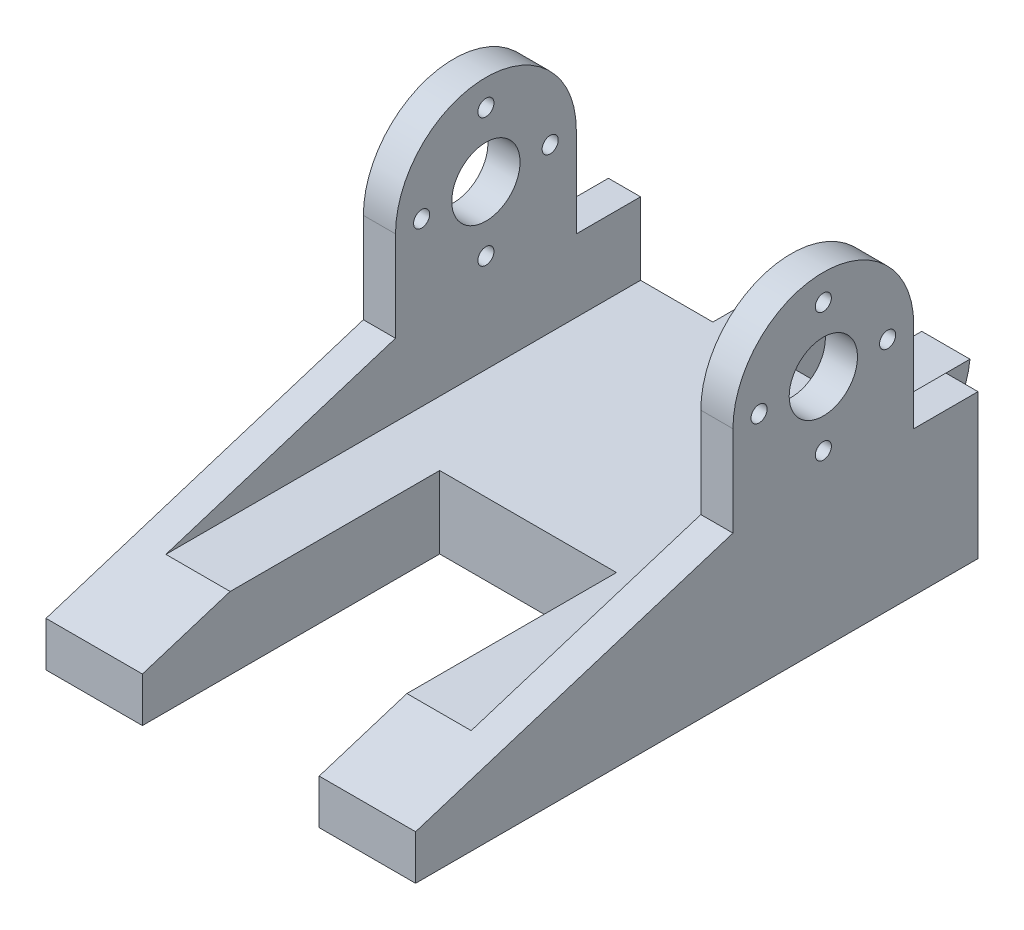
from build123d import *

# Parameters (mm, degrees)
SKETCH1_W                = 50
SKETCH1_H                = 170
BOSS_EXTRUDE1_DEPTH      = 55
SKETCH2_W                = 34
SKETCH2_H                = 27
CUT_EXTRUDE1_DEPTH       = 181.416185527
SKETCH3_W                = 10
SKETCH3_H                = 24
SKETCH3_R                = 4.25
SKETCH3_R_2              = 1
CUT_EXTRUDE2_DEPTH       = 186.539753153
SKETCH4_W                = 2
SKETCH4_H                = 24
CUT_EXTRUDE3_DEPTH       = 178.623196683
SKETCH5_W                = 6.25
SKETCH5_H                = 11.25
CUT_EXTRUDE4_DEPTH       = 186.539753153
SKETCH6_W                = 38
SKETCH6_H                = 10
CUT_EXTRUDE5_DEPTH       = 181.416185527
SKETCH8_W                = 13.25
SKETCH8_H                = 2.25
CUT_EXTRUDE7_DEPTH       = 186.539753153
SKETCH9_W                = 34
SKETCH9_H                = 35.25
CUT_EXTRUDE8_DEPTH       = 179.297679458
SKETCH11_W               = 13.25
SKETCH11_H               = 20.25
CUT_EXTRUDE9_DEPTH       = 184.480414486
SKETCH12_W               = 28.5
SKETCH12_H               = 15
BOSS_EXTRUDE2_DEPTH      = 8
SKETCH14_W               = 34
SKETCH14_H               = 15
SKETCH14_H_2             = 10.25
BOSS_EXTRUDE3_DEPTH      = 13.25
SKETCH16_R               = 4.5
SKETCH16_R_2             = 2.5
CUT_EXTRUDE13_DEPTH      = 8
SKETCH17_R               = 4.5
SKETCH17_W               = 55
SKETCH17_H               = 10.25
CUT_EXTRUDE15_DEPTH      = 175.384811552
SKETCH18_W               = 71.25
SKETCH18_H               = 27.5
SKETCH18_W_2             = 13.75
SKETCH18_W_3             = 16.25
BOSS_EXTRUDE4_DEPTH      = 50
SKETCH19_W               = 38
SKETCH19_H               = 7
CUT_EXTRUDE16_DEPTH      = 152.25227271
SKETCH20_W               = 57.5
SKETCH20_H               = 27.5
CUT_EXTRUDE17_DEPTH      = 102.137591923
CUT_EXTRUDE18_DEPTH      = 100.39221549
SKETCH22_W               = 82.5
SKETCH22_H               = 2.5
BOSS_EXTRUDE5_DEPTH      = 50
SKETCH24_W               = 22
SKETCH24_H               = 17
CUT_EXTRUDE19_DEPTH      = 101.710289941
SKETCH25_W               = 38
SKETCH25_H               = 38.136363636
CUT_EXTRUDE20_DEPTH      = 10
SKETCH27_W               = 38
SKETCH27_H               = 60.136363636
BOSS_EXTRUDE6_DEPTH      = 8.6
SKETCH29_W               = 38
SKETCH29_H               = 1.4
CUT_EXTRUDE21_DEPTH      = 85.601313414
BOSS_EXTRUDE7_DEPTH      = 50
SKETCH31_W               = 38
SKETCH31_H               = 17
CUT_EXTRUDE22_DEPTH      = 117.365802537
SKETCH32_W               = 100
SKETCH32_H               = 3
CUT_EXTRUDE23_DEPTH      = 101.710289941
SKETCH33_W               = 20
SKETCH33_H               = 10
SKETCH33_W_2             = 22
SKETCH33_H_2             = 45
CUT_EXTRUDE24_DEPTH      = 84.137311118
SKETCH34_W               = 8
SKETCH34_H               = 12
CUT_EXTRUDE25_DEPTH      = 76.0787087
BOSS_EXTRUDE8_DEPTH      = 8
SKETCH37_W               = 78
SKETCH37_H               = 9
SKETCH37_W_2             = 12
CUT_EXTRUDE27_DEPTH      = 93.48006542
FILLET1_R                = 10
CUT_EXTRUDE29_DEPTH      = 77.423572934
CUT_EXTRUDE29_DEPTH_BACK = 77.423572934
SKETCH38_W               = 2
SKETCH38_H               = 78
SKETCH38_W_2             = 46
SKETCH38_H_2             = 8


with BuildPart() as part:
    # Sketch1 → Boss-Extrude1 (new body)
    with BuildSketch(Plane.XY):
        with Locations((0, -85)):
            Rectangle(SKETCH1_W, SKETCH1_H)
    extrude(amount=-BOSS_EXTRUDE1_DEPTH)

    # Sketch2 → Cut-Extrude1 (cut, through all)
    with BuildSketch(Plane.XY):
        with Locations((0, -13.5)):
            Rectangle(SKETCH2_W, SKETCH2_H)
    extrude(amount=-CUT_EXTRUDE1_DEPTH, mode=Mode.SUBTRACT)

    # Sketch3 → Cut-Extrude2 (cut, through all)
    with BuildSketch(Plane(origin=(25, 0, 0), x_dir=(0, 0, -1), z_dir=(1, 0, 0))):
        with Locations((50, -12)):
            Rectangle(SKETCH3_W, SKETCH3_H)
        with Locations((5, -12)):
            Rectangle(SKETCH3_W, SKETCH3_H)
        with Locations(Location((27.5, -12.75, 0), (0, 0, 90))):
            Circle(SKETCH3_R)
        with Locations(Location((35.5, -12.75, 0), (0, 0, 90))):
            Circle(SKETCH3_R_2)
        with Locations(Location((27.5, -4.75, 0), (0, 0, 90))):
            Circle(SKETCH3_R_2)
        with Locations(Location((27.5, -20.75, 0), (0, 0, 90))):
            Circle(SKETCH3_R_2)
        with Locations(Location((19.5, -12.75, 0), (0, 0, 90))):
            Circle(SKETCH3_R_2)
    extrude(amount=-CUT_EXTRUDE2_DEPTH, mode=Mode.SUBTRACT)

    # Sketch4 → Cut-Extrude3 (cut, through all)
    with BuildSketch(Plane.XY.offset(-10)):
        with Locations((-18, -12)):
            Rectangle(SKETCH4_W, SKETCH4_H)
        with Locations((18, -12)):
            Rectangle(SKETCH4_W, SKETCH4_H)
    extrude(amount=-CUT_EXTRUDE3_DEPTH, mode=Mode.SUBTRACT)

    # Sketch5 → Cut-Extrude4 (cut, through all)
    with BuildSketch(Plane(origin=(25, 0, 0), x_dir=(0, 0, -1), z_dir=(1, 0, 0))):
        with BuildLine():
            Line((45, 0), (10, 0))
            Line((10, 0), (10, -12.75))
            Line((10, -12.75), (16.25, -12.75))
            ThreePointArc((16.25, -12.75), (27.5, -1.5), (38.75, -12.75))
            Line((38.75, -12.75), (45, -12.75))
            Line((45, -12.75), (45, 0))
        make_face()
        with Locations((13.125, -18.375)):
            Rectangle(SKETCH5_W, SKETCH5_H)
        with Locations((41.875, -18.375)):
            Rectangle(SKETCH5_W, SKETCH5_H)
    extrude(amount=-CUT_EXTRUDE4_DEPTH, mode=Mode.SUBTRACT)

    # Sketch6 → Cut-Extrude5 (cut, through all)
    with BuildSketch(Plane.XY):
        with Locations((0, -29)):
            Rectangle(SKETCH6_W, SKETCH6_H)
    extrude(amount=-CUT_EXTRUDE5_DEPTH, mode=Mode.SUBTRACT)

    # Sketch8 → Cut-Extrude7 (cut, through all)
    with BuildSketch(Plane(origin=(25, 0, 0), x_dir=(0, 0, -1), z_dir=(1, 0, 0))):
        with BuildLine():
            Line((27.5, -157.5), (27.5, -132.5))
            Line((27.5, -132.5), (13.25, -132.5))
            Line((13.25, -132.5), (13.25, -167.75))
            Line((13.25, -167.75), (17.25, -167.75))
            ThreePointArc((17.25, -167.75), (20.252155493, -160.502155493), (27.5, -157.5))
        make_face()
        with BuildLine():
            Line((41.75, -167.75), (41.75, -132.5))
            Line((41.75, -132.5), (27.5, -132.5))
            Line((27.5, -132.5), (27.5, -157.5))
            ThreePointArc((27.5, -157.5), (34.747844507, -160.502155493), (37.75, -167.75))
            Line((37.75, -167.75), (41.75, -167.75))
        make_face()
        with Locations((48.375, -168.875)):
            Rectangle(SKETCH8_W, SKETCH8_H)
        with Locations((6.625, -168.875)):
            Rectangle(SKETCH8_W, SKETCH8_H)
        with BuildLine():
            Line((17.25, -167.75), (13.25, -167.75))
            Line((13.25, -167.75), (13.25, -170))
            Line((13.25, -170), (17.5, -170))
            ThreePointArc((17.5, -170), (17.31269172, -168.881923142), (17.25, -167.75))
        make_face()
        with BuildLine():
            Line((41.75, -170), (41.75, -167.75))
            Line((41.75, -167.75), (37.75, -167.75))
            ThreePointArc((37.75, -167.75), (37.68730828, -168.881923142), (37.5, -170))
            Line((37.5, -170), (41.75, -170))
        make_face()
        with BuildLine():
            Line((27.5, -167.75), (27.5, -157.5))
            ThreePointArc((27.5, -157.5), (20.252155493, -160.502155493), (17.25, -167.75))
            Line((17.25, -167.75), (27.5, -167.75))
        make_face()
        with BuildLine():
            ThreePointArc((37.75, -167.75), (34.747844507, -160.502155493), (27.5, -157.5))
            Line((27.5, -157.5), (27.5, -167.75))
            Line((27.5, -167.75), (37.75, -167.75))
        make_face()
        with BuildLine():
            Line((27.5, -170), (27.5, -167.75))
            Line((27.5, -167.75), (17.25, -167.75))
            ThreePointArc((17.25, -167.75), (17.31269172, -168.881923142), (17.5, -170))
            Line((17.5, -170), (27.5, -170))
        make_face()
        with BuildLine():
            ThreePointArc((37.5, -170), (37.68730828, -168.881923142), (37.75, -167.75))
            Line((37.75, -167.75), (27.5, -167.75))
            Line((27.5, -167.75), (27.5, -170))
            Line((27.5, -170), (37.5, -170))
        make_face()
    extrude(amount=-CUT_EXTRUDE7_DEPTH, mode=Mode.SUBTRACT)

    # Sketch9 → Cut-Extrude8 (cut, through all)
    with BuildSketch(Plane.XY):
        with Locations((0, -150.125)):
            Rectangle(SKETCH9_W, SKETCH9_H)
    extrude(amount=-CUT_EXTRUDE8_DEPTH, mode=Mode.SUBTRACT)

    # Sketch11 → Cut-Extrude9 (cut, through all)
    with BuildSketch(Plane(origin=(25, 0, 0), x_dir=(0, 0, -1), z_dir=(1, 0, 0))):
        with BuildLine():
            ThreePointArc((17.25, -167.75), (20.252155493, -160.502155493), (27.5, -157.5))
            Line((27.5, -157.5), (27.5, -147.5))
            Line((27.5, -147.5), (13.25, -147.5))
            Line((13.25, -147.5), (13.25, -167.75))
            Line((13.25, -167.75), (17.25, -167.75))
        make_face()
        with BuildLine():
            Line((27.5, -147.5), (27.5, -157.5))
            ThreePointArc((27.5, -157.5), (34.747844507, -160.502155493), (37.75, -167.75))
            Line((37.75, -167.75), (41.75, -167.75))
            Line((41.75, -167.75), (41.75, -147.5))
            Line((41.75, -147.5), (27.5, -147.5))
        make_face()
        with Locations((48.375, -157.625)):
            Rectangle(SKETCH11_W, SKETCH11_H)
        with Locations((6.625, -157.625)):
            Rectangle(SKETCH11_W, SKETCH11_H)
    extrude(amount=-CUT_EXTRUDE9_DEPTH, mode=Mode.SUBTRACT)

    # Sketch12 → Boss-Extrude2 (add)
    with BuildSketch(Plane(origin=(25, 0, 0), x_dir=(0, 0, -1), z_dir=(1, 0, 0))):
        with Locations((27.5, -140)):
            Rectangle(SKETCH12_W, SKETCH12_H)
    boss_extrude2 = extrude(amount=-BOSS_EXTRUDE2_DEPTH)

    # Mirror1: Boss-Extrude2 across plane
    add(boss_extrude2.mirror(Plane(origin=(0, 0, 0), x_dir=(0, 0, 1), z_dir=(1, 0, 0))))

    # Sketch14 → Boss-Extrude3 (add)
    with BuildSketch(Plane.XY):
        with Locations((0, -140)):
            Rectangle(SKETCH14_W, SKETCH14_H)
        with Locations((0, -152.625)):
            Rectangle(SKETCH14_W, SKETCH14_H_2)
    boss_extrude3 = extrude(amount=-BOSS_EXTRUDE3_DEPTH)

    # Mirror2: Boss-Extrude3 across plane
    add(boss_extrude3.mirror(Plane.XY.offset(-27.5)))

    # Sketch16 → Cut-Extrude13 (cut)
    # profile 1 of 3: a face of its own
    with BuildSketch(Plane(origin=(25, 0, 0), x_dir=(0, 0, -1), z_dir=(1, 0, 0))):
        with Locations(Location((16.5, -135.75, 0), (0, 0, 90))):
            Circle(SKETCH16_R)
        with Locations((16.5, -135.75)):
            Circle(SKETCH16_R_2, mode=Mode.SUBTRACT)
    # profile 2 of 3: a face of its own
    with BuildSketch(Plane(origin=(25, 0, 0), x_dir=(0, 0, -1), z_dir=(1, 0, 0))):
        with Locations((16.5, -135.75)):
            Circle(SKETCH16_R_2)
    # profile 3 of 3: a face of its own
    with BuildSketch(Plane(origin=(25, 0, 0), x_dir=(0, 0, -1), z_dir=(1, 0, 0))):
        with Locations(Location((38.5, -135.75, 0), (0, 0, 90))):
            Circle(SKETCH16_R)
    cut_extrude13 = extrude(amount=-CUT_EXTRUDE13_DEPTH, mode=Mode.SUBTRACT)

    # Mirror3: Cut-Extrude13 across plane
    add(cut_extrude13.mirror(Plane(origin=(0, 0, 0), x_dir=(0, 0, 1), z_dir=(1, 0, 0))), mode=Mode.SUBTRACT)

    # Sketch17 → Cut-Extrude15 (cut, through all)
    # profile 1 of 4: a face of its own
    with BuildSketch(Plane(origin=(25, 0, 0), x_dir=(0, 0, -1), z_dir=(1, 0, 0))):
        Polygon((55, -51.5), (27.5, -51.5), (0, -51.5), (0, -147.5), (55, -147.5), align=None)
        with Locations((16.5, -135.75)):
            Circle(SKETCH17_R, mode=Mode.SUBTRACT)
        with Locations((38.5, -135.75)):
            Circle(SKETCH17_R, mode=Mode.SUBTRACT)
    # profile 2 of 4: a face of its own
    with BuildSketch(Plane(origin=(25, 0, 0), x_dir=(0, 0, -1), z_dir=(1, 0, 0))):
        with Locations((27.5, -152.625)):
            Rectangle(SKETCH17_W, SKETCH17_H)
    # profile 3 of 4: a face of its own
    with BuildSketch(Plane(origin=(25, 0, 0), x_dir=(0, 0, -1), z_dir=(1, 0, 0))):
        with Locations((38.5, -135.75)):
            Circle(SKETCH17_R)
    # profile 4 of 4: a face of its own
    with BuildSketch(Plane(origin=(25, 0, 0), x_dir=(0, 0, -1), z_dir=(1, 0, 0))):
        with Locations((16.5, -135.75)):
            Circle(SKETCH17_R)
    extrude(amount=-CUT_EXTRUDE15_DEPTH, mode=Mode.SUBTRACT)

    # Sketch18 → Boss-Extrude4 (add)
    with BuildSketch(Plane(origin=(25, 0, 0), x_dir=(0, 0, -1), z_dir=(1, 0, 0))):
        with Locations((-35.625, -37.75)):
            Rectangle(SKETCH18_W, SKETCH18_H)
        with Locations((61.875, -37.75)):
            Rectangle(SKETCH18_W_2, SKETCH18_H)
        Polygon((38.75, -51.5), (38.75, -24), (16.25, -24), (0, -24), (0, -51.5), align=None)
        with Locations((46.875, -37.75)):
            Rectangle(SKETCH18_W_3, SKETCH18_H)
    extrude(amount=-BOSS_EXTRUDE4_DEPTH)

    # Sketch19 → Cut-Extrude16 (cut, through all)
    with BuildSketch(Plane.XY.offset(71.25)):
        with Locations((0, -27.5)):
            Rectangle(SKETCH19_W, SKETCH19_H)
    extrude(amount=-CUT_EXTRUDE16_DEPTH, mode=Mode.SUBTRACT)

    # Sketch20 → Cut-Extrude17 (cut, through all)
    with BuildSketch(Plane(origin=(25, 0, 0), x_dir=(0, 0, -1), z_dir=(1, 0, 0))):
        with Locations((-42.5, -37.75)):
            Rectangle(SKETCH20_W, SKETCH20_H)
    extrude(amount=-CUT_EXTRUDE17_DEPTH, mode=Mode.SUBTRACT)

    # Sketch21 → Cut-Extrude18 (cut, through all)
    with BuildSketch(Plane(origin=(25, 0, 0), x_dir=(0, 0, -1), z_dir=(1, 0, 0))):
        Polygon((16.25, -24), (-13.75, -51.5), (-13.75, -24), align=None)
    extrude(amount=-CUT_EXTRUDE18_DEPTH, mode=Mode.SUBTRACT)

    # Sketch22 → Boss-Extrude5 (add)
    with BuildSketch(Plane(origin=(25, 0, 0), x_dir=(0, 0, -1), z_dir=(1, 0, 0))):
        with Locations((27.5, -52.75)):
            Rectangle(SKETCH22_W, SKETCH22_H)
    extrude(amount=-BOSS_EXTRUDE5_DEPTH)

    # Sketch24 → Cut-Extrude19 (cut, through all)
    with BuildSketch(Plane(origin=(25, 0, 0), x_dir=(0, 0, -1), z_dir=(1, 0, 0))):
        with Locations((57.75, -32.5)):
            Rectangle(SKETCH24_W, SKETCH24_H)
    extrude(amount=-CUT_EXTRUDE19_DEPTH, mode=Mode.SUBTRACT)

    # Sketch25 → Cut-Extrude20 (cut)
    with BuildSketch(Plane(origin=(0, -31, 0), x_dir=(1, 0, 0), z_dir=(0, 1, 0))):
        with Locations((0, 27.681818182)):
            Rectangle(SKETCH25_W, SKETCH25_H)
    extrude(amount=-CUT_EXTRUDE20_DEPTH, mode=Mode.SUBTRACT)

    # Sketch27 → Boss-Extrude6 (add)
    with BuildSketch(Plane(origin=(0, -41, 0), x_dir=(1, 0, 0), z_dir=(0, 1, 0))):
        with Locations((0, 38.681818182)):
            Rectangle(SKETCH27_W, SKETCH27_H)
    extrude(amount=BOSS_EXTRUDE6_DEPTH)

    # Sketch29 → Cut-Extrude21 (cut, through all)
    with BuildSketch(Plane(origin=(0, 0, -8.613636364), x_dir=(-1, 0, 0), z_dir=(0, 0, -1))):
        with Locations((0, -31.7)):
            Rectangle(SKETCH29_W, SKETCH29_H)
    extrude(amount=-CUT_EXTRUDE21_DEPTH, mode=Mode.SUBTRACT)

    # Sketch30 → Boss-Extrude7 (add)
    with BuildSketch(Plane.ZY.offset(25)):
        Polygon((31.25, -38.957214173), (-16.25, -24), (-7.086363636, -32.4), (13.75, -51.5), (13.75, -53.914428346), (31.25, -53.914428346), align=None)
        Polygon((-16.25, -24), (-16.25, -32.4), (-7.086363636, -32.4), align=None)
    extrude(amount=-BOSS_EXTRUDE7_DEPTH)

    # Sketch31 → Cut-Extrude22 (cut, through all)
    with BuildSketch(Plane(origin=(0, 0, -68.75), x_dir=(-1, 0, 0), z_dir=(0, 0, -1))):
        with Locations((0, -32.5)):
            Rectangle(SKETCH31_W, SKETCH31_H)
    extrude(amount=-CUT_EXTRUDE22_DEPTH, mode=Mode.SUBTRACT)

    # Sketch32 → Cut-Extrude23 (cut, through all)
    with BuildSketch(Plane(origin=(25, 0, 0), x_dir=(0, 0, -1), z_dir=(1, 0, 0))):
        with Locations((18.75, -52.5)):
            Rectangle(SKETCH32_W, SKETCH32_H)
    extrude(amount=-CUT_EXTRUDE23_DEPTH, mode=Mode.SUBTRACT)

    # Sketch33 → Cut-Extrude24 (cut, through all)
    with BuildSketch(Plane(origin=(0, -41, 0), x_dir=(1, 0, 0), z_dir=(0, 1, 0))):
        Polygon((-10, 68.75), (-25, 68.75), (-25, 46.75), (-19, 46.75), (-10, 46.75), (-10, 58.75), align=None)
        Polygon((25, 68.75), (10, 68.75), (10, 58.75), (10, 46.75), (19, 46.75), (25, 46.75), align=None)
        with Locations((0, 63.75)):
            Rectangle(SKETCH33_W, SKETCH33_H)
        with Locations((0, -8.75)):
            Rectangle(SKETCH33_W_2, SKETCH33_H_2)
    extrude(amount=-CUT_EXTRUDE24_DEPTH, mode=Mode.SUBTRACT)

    # Sketch34 → Cut-Extrude25 (cut, through all)
    with BuildSketch(Plane(origin=(0, -41, 0), x_dir=(1, 0, 0), z_dir=(0, 1, 0))):
        with Locations((0, 52.75)):
            Rectangle(SKETCH34_W, SKETCH34_H)
    extrude(amount=-CUT_EXTRUDE25_DEPTH, mode=Mode.SUBTRACT)

    # Sketch36 → Boss-Extrude8 (add)
    with BuildSketch(Plane(origin=(0, -41, 0), x_dir=(1, 0, 0), z_dir=(0, 1, 0))):
        Polygon((4, 58.75), (4, 46.75), (-4, 46.75), (-4, 58.75), (-10, 58.75), (-10, 46.75), (-19, 46.75), (-19, -31.25), (-11, -31.25), (-11, 13.75), (11, 13.75), (11, -31.25), (19, -31.25), (19, 46.75), (10, 46.75), (10, 58.75), align=None)
    extrude(amount=BOSS_EXTRUDE8_DEPTH)

    # Sketch37 → Cut-Extrude27 (cut, through all)
    with BuildSketch(Plane(origin=(25, 0, 0), x_dir=(0, 0, -1), z_dir=(1, 0, 0))):
        with Locations((7.75, -46.5)):
            Rectangle(SKETCH37_W, SKETCH37_H)
        Polygon((-31.25, -33), (-31.25, -38.957214173), (-12.331525614, -33), align=None)
        with Locations((52.75, -46.5)):
            Rectangle(SKETCH37_W_2, SKETCH37_H)
    extrude(amount=-CUT_EXTRUDE27_DEPTH, mode=Mode.SUBTRACT)

    # Fillet1
    # the kernel refuses this fillet: 10 mm, written as the material it takes off along each edge
    with BuildSketch(Plane(origin=(20.874685928, -42, -58.75), x_dir=(0, 0, 1), z_dir=(-1, 0, 0)), Plane(origin=(34.874685928, -42, -58.75), x_dir=(0, 0, 1), z_dir=(-1, 0, 0))) as fillet1_piece_1:
        with BuildLine():
            CenterArc((9.949874371, 10), FILLET1_R, 185.739170477, 84.260829523)
            Line((0, 9), (-0.198997487, 8.98))
            ThreePointArc((-0.198997487, 8.98), (-0.2, 4.5), (-0.2, 0))
            Line((-0.2, 0), (0, -0.2))
            Line((0, -0.2), (9.949874371, -0.2))
            Line((9.949874371, -0.2), (9.949874371, 0))
        make_face()
    extrude(amount=55.749371855, mode=Mode.SUBTRACT)

    # Sketch38 → Cut-Extrude29 (cut, two sides: drawn at the far end of the back side and taken through both)
    with BuildSketch(Plane(origin=(0, 0, 0), x_dir=(1, 0, 0), z_dir=(0, 1, 0)).offset(-CUT_EXTRUDE29_DEPTH_BACK)):
        with Locations((-24, 7.75)):
            Rectangle(SKETCH38_W, SKETCH38_H)
        with Locations((24, 7.75)):
            Rectangle(SKETCH38_W, SKETCH38_H)
        with Locations((0, -27.25)):
            Rectangle(SKETCH38_W_2, SKETCH38_H_2)
    extrude(amount=CUT_EXTRUDE29_DEPTH + CUT_EXTRUDE29_DEPTH_BACK, mode=Mode.SUBTRACT)


solid = part.part
